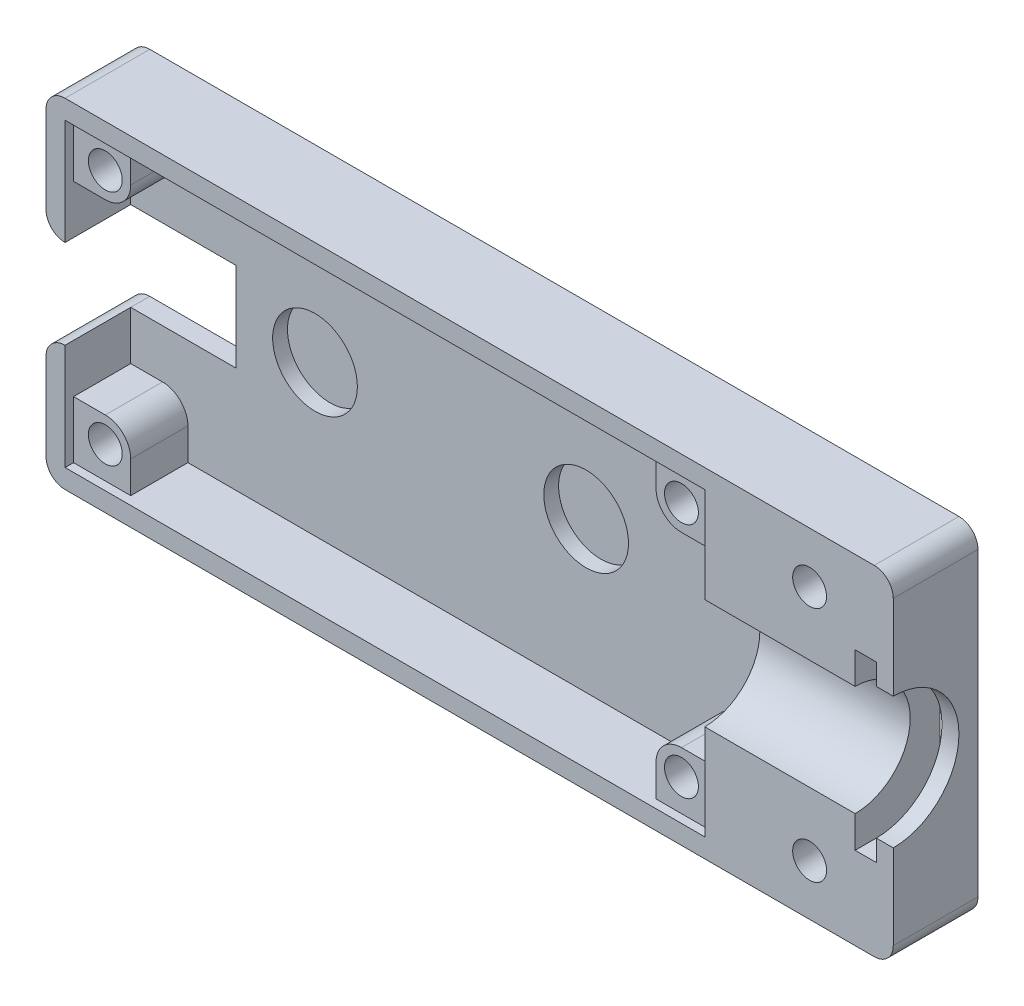
from build123d import *

# Parameters (mm, degrees)
BODY_DEPTH          = 10
SKETCH10_W          = 75.5
SKETCH10_H          = 35.5
PCB_RECESS_DEPTH    = 7.75
SKETCH11_R          = 3
PCB_BOSS_DEPTH      = 6.75
FILLET2_R           = 2.25
SKETCH12_R          = 2
M3_INSERTS_DEPTH    = 5.5
FILLET3_R           = 2.25
SKETCH27_R          = 5
MAGNETS_DEPTH       = 1.75
SKETCH29_W          = 2
SKETCH29_H          = 7.75
SKETCH30_W          = 2.5
SKETCH30_H          = 20.5
HIROSE_MID_DEPTH    = 109.166538264
SKETCH31_R          = 2
CUT_EXTRUDE14_DEPTH = 5.5
SKETCH32_W          = 17.75
SKETCH32_H          = 6.5


with BuildPart() as part:
    # Sketch4 → body (new body)
    with BuildSketch(Plane.XY):
        Polygon((0, 40), (0, 25.25), (14.7, 25.25), (14.7, 14.75), (0, 14.75), (0, 0), (100, 0), (100, 40), align=None)
    extrude(amount=BODY_DEPTH)

    # Sketch10 → pcb-recess (cut)
    with BuildSketch(Plane.XY.offset(10)):
        with Locations((40, 20)):
            Rectangle(SKETCH10_W, SKETCH10_H)
    extrude(amount=-PCB_RECESS_DEPTH, mode=Mode.SUBTRACT)

    # Sketch11 → pcb-boss (add)
    with BuildSketch(Plane.XY.offset(2.25)):
        with Locations((6, 34)):
            Circle(SKETCH11_R)
        with BuildLine():
            ThreePointArc((6, 31), (3.878679656, 36.121320344), (9, 34))
            Line((9, 34), (9, 37.75))
            Line((9, 37.75), (2.25, 37.75))
            Line((2.25, 37.75), (2.25, 31))
            Line((2.25, 31), (6, 31))
        make_face()
        with BuildLine():
            Line((77.75, 37.75), (71, 37.75))
            Line((71, 37.75), (71, 34))
            ThreePointArc((71, 34), (74, 37), (77, 34))
            ThreePointArc((77, 34), (76.121320344, 31.878679656), (74, 31))
            Line((74, 31), (77.75, 31))
            Line((77.75, 31), (77.75, 37.75))
        make_face()
        with Locations((74, 34)):
            Circle(SKETCH11_R)
        with Locations((74, 6)):
            Circle(SKETCH11_R)
        with BuildLine():
            Line((77.75, 2.25), (77.75, 9))
            Line((77.75, 9), (74, 9))
            ThreePointArc((74, 9), (76.121320344, 8.121320344), (77, 6))
            ThreePointArc((77, 6), (74, 3), (71, 6))
            Line((71, 6), (71, 2.25))
            Line((71, 2.25), (77.75, 2.25))
        make_face()
        with Locations((6, 6)):
            Circle(SKETCH11_R)
        with BuildLine():
            Line((2.25, 2.25), (9, 2.25))
            Line((9, 2.25), (9, 6))
            ThreePointArc((9, 6), (3.878679656, 3.878679656), (6, 9))
            Line((6, 9), (2.25, 9))
            Line((2.25, 9), (2.25, 2.25))
        make_face()
    extrude(amount=PCB_BOSS_DEPTH)

    # Fillet2
    fillet2_edges = [part.edges().sort_by_distance(p)[0] for p in [
        (0, 14.75, 5),
        (0, 25.25, 5),
    ]]
    fillet(fillet2_edges, radius=FILLET2_R - 0.0001)  # a hair under: the kernel refuses the full size

    # Sketch12 → m3-inserts (cut)
    with BuildSketch(Plane.XY.offset(9)):
        with Locations((6, 34)):
            Circle(SKETCH12_R)
        with Locations((74, 34)):
            Circle(SKETCH12_R)
        with Locations((74, 6)):
            Circle(SKETCH12_R)
        with Locations((6, 6)):
            Circle(SKETCH12_R)
    extrude(amount=-M3_INSERTS_DEPTH, mode=Mode.SUBTRACT)

    # Fillet3
    fillet3_edges = [part.edges().sort_by_distance(p)[0] for p in [
        (0, 40, 5),
        (100, 40, 5),
        (100, 0, 5),
        (0, 0, 5),
    ]]
    fillet(fillet3_edges, radius=FILLET3_R)

    # Sketch27 → magnets (cut)
    with BuildSketch(Plane.XY.offset(2.25)):
        with Locations((24, 20)):
            Circle(SKETCH27_R)
        with Locations((56, 20)):
            Circle(SKETCH27_R)
    extrude(amount=-MAGNETS_DEPTH, mode=Mode.SUBTRACT)

    # Sketch29 → hirose-front (revolve, cut)
    with BuildSketch(Plane.XY.offset(10)):
        with Locations((99, 23.875)):
            Rectangle(SKETCH29_W, SKETCH29_H)
    revolve(axis=Axis((100, 20, 10), (-1, 0, 0)), mode=Mode.SUBTRACT)

    # Sketch30 → hirose-mid (cut, through all)
    with BuildSketch(Plane.XY.offset(10)):
        with Locations((96.75, 20)):
            Rectangle(SKETCH30_W, SKETCH30_H)
    extrude(amount=-HIROSE_MID_DEPTH, mode=Mode.SUBTRACT)

    # Sketch31 → Cut-Extrude14 (cut)
    with BuildSketch(Plane.XY.offset(10)):
        with Locations((90.125, 34)):
            Circle(SKETCH31_R)
        with Locations(Location((90.125, 6, 0), (0, 0, 180))):
            Circle(SKETCH31_R)
    extrude(amount=-CUT_EXTRUDE14_DEPTH, mode=Mode.SUBTRACT)

    # Sketch32 → hirose-back (revolve, cut)
    with BuildSketch(Plane.XY.offset(10)):
        with Locations((86.625, 23.25)):
            Rectangle(SKETCH32_W, SKETCH32_H)
    revolve(axis=Axis((77.75, 20, 10), (1, 0, 0)), mode=Mode.SUBTRACT)


solid = part.part
